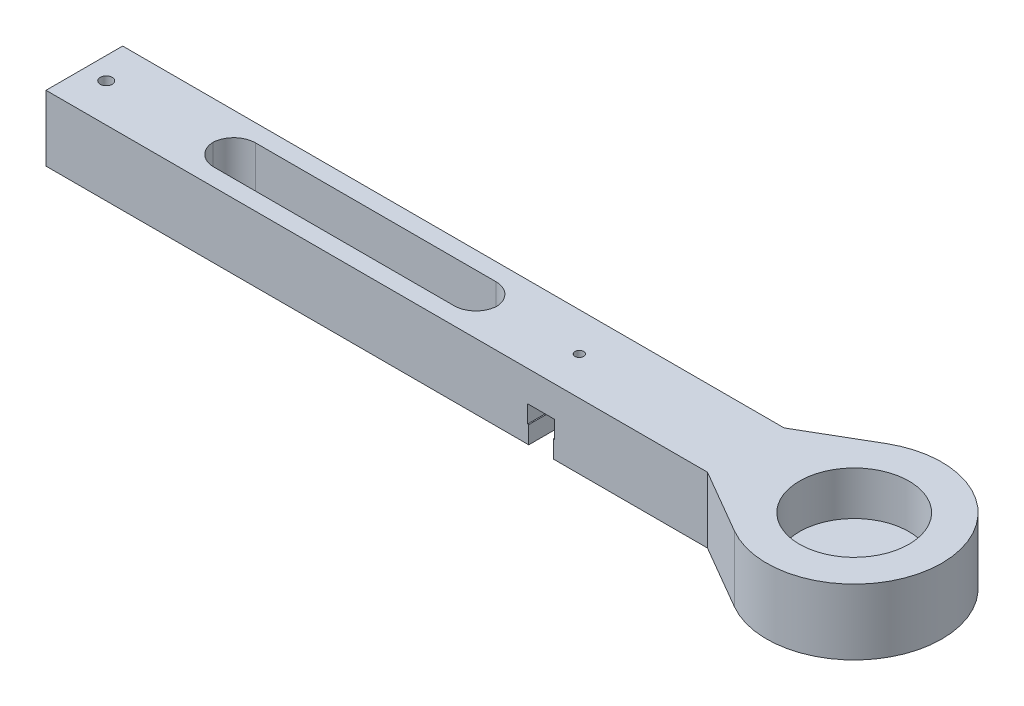
from build123d import *

# Parameters (mm, degrees)
SKETCH2_W           = 247
SKETCH2_H           = 35
BOSS_EXTRUDE1_DEPTH = 30
SKETCH3_R           = 5.6
CUT_EXTRUDE1_DEPTH  = 250.429849858
CUT_EXTRUDE2_DEPTH  = 22
SKETCH6_W           = 22.496439662
SKETCH6_H           = 14
BOSS_EXTRUDE3_DEPTH = 38
CUT_EXTRUDE4_DEPTH  = 17.5
SKETCH9_R           = 2
CUT_EXTRUDE5_DEPTH  = 38
SKETCH15_R          = 2.75
CUT_EXTRUDE10_DEPTH = 9
CUT_EXTRUDE11_DEPTH = 21
SKETCH17_W          = 129.66543269
SKETCH17_H          = 19.076880406
CUT_EXTRUDE12_DEPTH = 250.429849858
FILLET1_R           = 10
SKETCH19_W          = 35
SKETCH19_H          = 30
BOSS_EXTRUDE5_DEPTH = 55
BOSS_EXTRUDE4_DEPTH = 30
SKETCH21_R          = 25
CUT_EXTRUDE14_DEPTH = 20


with BuildPart() as part:
    # Sketch2 → Boss-Extrude1 (new body)
    with BuildSketch(Plane(origin=(0, 0, 0), x_dir=(1, 0, 0), z_dir=(0, 1, 0))):
        with Locations((-123.5, 0)):
            Rectangle(SKETCH2_W, SKETCH2_H)
    extrude(amount=BOSS_EXTRUDE1_DEPTH)

    # Sketch3 → Cut-Extrude1 (cut, through all)
    with BuildSketch(Plane.XZ):
        with Locations(Location((-21, 0, 0), (0, 0, 270))):
            Circle(SKETCH3_R)
    extrude(amount=-CUT_EXTRUDE1_DEPTH, mode=Mode.SUBTRACT)

    # Sketch4 → Cut-Extrude2 (cut)
    with BuildSketch(Plane(origin=(0, 30, 0), x_dir=(1, 0, 0), z_dir=(0, 1, 0))):
        Polygon((-14.9, 3.521836642), (-21, 7.043673284), (-27.1, 3.521836642), (-27.1, -3.521836642), (-21, -7.043673284), (-14.9, -3.521836642), align=None)
    extrude(amount=-CUT_EXTRUDE2_DEPTH, mode=Mode.SUBTRACT)

    # Sketch6 → Boss-Extrude3 (add)
    with BuildSketch(Plane(origin=(0, 0, 0), x_dir=(0, 0, -1), z_dir=(1, 0, 0))):
        with Locations((0.204742288, 23)):
            Rectangle(SKETCH6_W, SKETCH6_H)
    extrude(amount=-BOSS_EXTRUDE3_DEPTH)

    # Sketch7 → Cut-Extrude4 (cut)
    with BuildSketch(Plane.XY.offset(17.5)):
        Polygon((-21, 16), (-14.9, 16), (-14.9, 8), (-15.4, 8), (-15.4, 0), (-26.6, 0), (-26.6, 8), (-27.1, 8), (-27.1, 16), align=None)
    extrude(amount=-CUT_EXTRUDE4_DEPTH, mode=Mode.SUBTRACT)

    # Sketch9 → Cut-Extrude5 (cut)
    with BuildSketch(Plane(origin=(0, 30, 0), x_dir=(1, 0, 0), z_dir=(0, 1, 0))):
        with Locations(Location((-21, 0, 0), (0, 0, 270))):
            Circle(SKETCH9_R)
    extrude(amount=-CUT_EXTRUDE5_DEPTH, mode=Mode.SUBTRACT)

    # Sketch15 → Cut-Extrude10 (cut)
    with BuildSketch(Plane(origin=(0, 30, 0), x_dir=(1, 0, 0), z_dir=(0, 1, 0))):
        with Locations(Location((-237, 0, 0), (0, 0, 270))):
            Circle(SKETCH15_R)
    extrude(amount=-CUT_EXTRUDE10_DEPTH, mode=Mode.SUBTRACT)

    # Sketch16 → Cut-Extrude11 (cut)
    with BuildSketch(Plane.XZ):
        Polygon((-241.130206964, 2.650419546), (-241.36043414, -2.25165438), (-237.230227176, -4.902073926), (-232.869793036, -2.650419546), (-232.63956586, 2.25165438), (-236.769772824, 4.902073926), align=None)
    extrude(amount=-CUT_EXTRUDE11_DEPTH, mode=Mode.SUBTRACT)

    # Sketch17 → Cut-Extrude12 (cut, through all)
    with BuildSketch(Plane(origin=(0, 30, 0), x_dir=(1, 0, 0), z_dir=(0, 1, 0))):
        with Locations((-123.5, 0)):
            Rectangle(SKETCH17_W, SKETCH17_H)
    extrude(amount=-CUT_EXTRUDE12_DEPTH, mode=Mode.SUBTRACT)

    # Fillet1
    # the kernel refuses this fillet: 10 mm, written as the material it adds along each edge
    with BuildSketch(Plane(origin=(-58.667283655, 30, 9.538440203), x_dir=(0, 0, -1), z_dir=(0, -1, 0))) as fillet1_piece_1:
        with BuildLine():
            CenterArc((FILLET1_R, -FILLET1_R), FILLET1_R, 90, 90)
            Line((0, -FILLET1_R), (0, 0))
            Line((0, 0), (FILLET1_R, 0))
        make_face()
    extrude(amount=30)
    with BuildSketch(Plane(origin=(-58.667283655, 30, -9.538440203), x_dir=(0, 0, 1), z_dir=(0, -1, 0)), Plane(origin=(-188.332716345, 30, -9.538440203), x_dir=(1, 0, 0), z_dir=(0, -1, 0)), Plane(origin=(-188.332716345, 30, 9.538440203), x_dir=(0, 0, -1), z_dir=(0, -1, 0))) as fillet1_piece_2:
        with BuildLine():
            CenterArc((FILLET1_R, FILLET1_R), FILLET1_R, 180, 90)
            Line((0, FILLET1_R), (0, 0))
            Line((0, 0), (FILLET1_R, 0))
        make_face()
    extrude(amount=30)

    # Sketch19 → Boss-Extrude5 (add)
    with BuildSketch(Plane(origin=(0, 0, 0), x_dir=(0, 0, -1), z_dir=(1, 0, 0))):
        with Locations((0, 15)):
            Rectangle(SKETCH19_W, SKETCH19_H)
    extrude(amount=BOSS_EXTRUDE5_DEPTH)

    # Sketch18 → Boss-Extrude4 (add)
    with BuildSketch(Plane(origin=(0, 30, 0), x_dir=(1, 0, 0), z_dir=(0, 1, 0))):
        with BuildLine():
            Line((55, 17.5), (55, -17.5))
            Line((55, -17.5), (84.405509337, -34.58567742))
            ThreePointArc((84.405509337, -34.58567742), (144.501054052, 0), (84.405509337, 34.58567742))
            Line((84.405509337, 34.58567742), (55, 17.5))
        make_face()
    extrude(amount=-BOSS_EXTRUDE4_DEPTH)

    # Sketch21 → Cut-Extrude14 (cut)
    with BuildSketch(Plane(origin=(0, 30, 0), x_dir=(1, 0, 0), z_dir=(0, 1, 0))):
        with Locations(Location((104.501054052, 0, 0), (0, 0, 270))):
            Circle(SKETCH21_R)
    extrude(amount=-CUT_EXTRUDE14_DEPTH, mode=Mode.SUBTRACT)


solid = part.part
